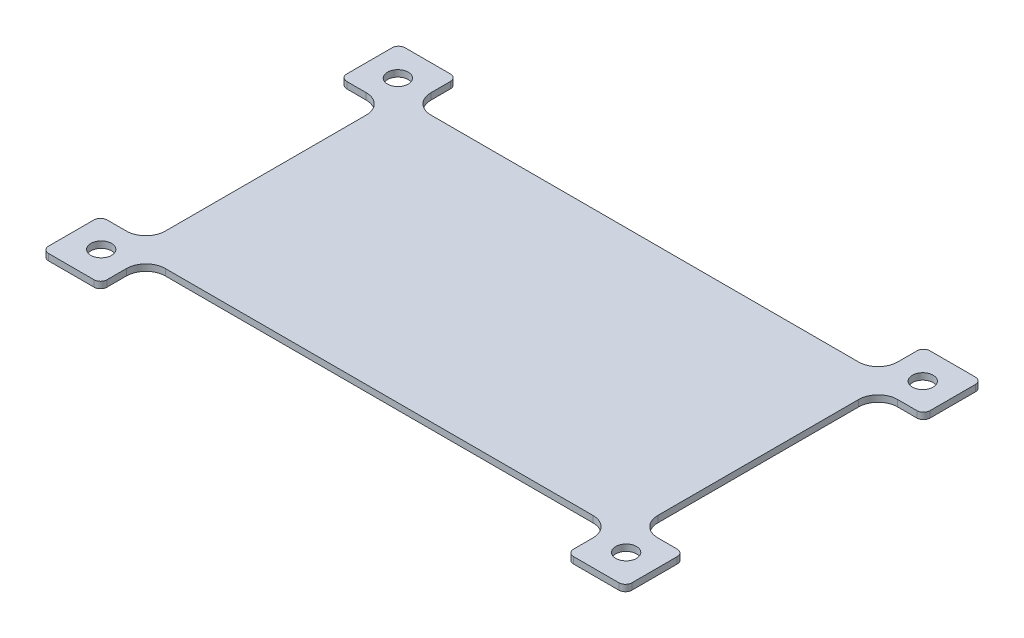
from build123d import *

# Parameters (mm, degrees)
SKETCH1_W            = 76
SKETCH1_H            = 41
BOSS_EXTRUDE1_DEPTH  = 1
SKETCH2_W            = 9
SKETCH2_H            = 9
BOSS_EXTRUDE2_DEPTH  = 1
SKETCH3_R            = 1.6
CUT_EXTRUDE1_DEPTH   = 1
FILLET1_R            = 1
FILLET3_R            = 3
FILLET1_OF_MIRROR2_R = 1
MIRROR3_OUTLINE_R    = 1.6
MIRROR3_DEPTH        = 1
FILLET4_R            = 3


# Read off the part's stored shape, not the designer's step: Mirror3
with BuildPart() as part:
    # Sketch1 → Boss-Extrude1 (new body)
    with BuildSketch(Plane(origin=(0, 0, 0), x_dir=(1, 0, 0), z_dir=(0, 1, 0))):
        Rectangle(SKETCH1_W, SKETCH1_H)
    boss_extrude1 = extrude(amount=BOSS_EXTRUDE1_DEPTH)

    # Sketch2 → Boss-Extrude2 (add)
    with BuildSketch(Plane(origin=(0, 1, 0), x_dir=(1, 0, 0), z_dir=(0, 1, 0))):
        with Locations((40.5, 23)):
            Rectangle(SKETCH2_W, SKETCH2_H)
    boss_extrude2 = extrude(amount=-BOSS_EXTRUDE2_DEPTH)

    # Sketch3 → Cut-Extrude1 (cut)
    with BuildSketch(Plane(origin=(0, 1, 0), x_dir=(1, 0, 0), z_dir=(0, 1, 0))):
        with Locations(Location((40.5, 22.887482194, 0), (0, 0, 270))):
            Circle(SKETCH3_R)
    cut_extrude1 = extrude(amount=-CUT_EXTRUDE1_DEPTH, mode=Mode.SUBTRACT)

    # Fillet1
    fillet1_edges = [part.edges().sort_by_distance(p)[0] for p in [
        (45, 0.5, -18.5),
        (36, 0.5, -27.5),
        (45, 0.5, -27.5),
    ]]
    fillet(fillet1_edges, radius=FILLET1_R)

    # Fillet3
    fillet3_edges = [part.edges().sort_by_distance(p)[0] for p in [
        (36, 0.5, -20.5),
        (38, 0.5, -18.5),
    ]]
    fillet(fillet3_edges, radius=FILLET3_R)

    # Mirror2: Boss-Extrude1, Boss-Extrude2, Cut-Extrude1 across plane
    add(boss_extrude1.mirror(Plane.XY))
    add(boss_extrude2.mirror(Plane.XY))
    add(cut_extrude1.mirror(Plane.XY), mode=Mode.SUBTRACT)

    # Fillet1 of Mirror2
    fillet1_of_mirror2_edges = [part.edges().sort_by_distance(p)[0] for p in [
        (45, 0.5, 18.5),
        (36, 0.5, 27.5),
        (45, 0.5, 27.5),
    ]]
    fillet(fillet1_of_mirror2_edges, radius=FILLET1_OF_MIRROR2_R)

    # Mirror3 outline → Mirror3 (add)
    # profile 1 of 2: a face of its own
    with BuildSketch(Plane(origin=(0, 0, 0), x_dir=(1, 0, 0), z_dir=(0, 1, 0))):
        with BuildLine():
            Line((-38, -20.5), (-38, -18.5))
            Line((-38, -18.5), (-44, -18.5))
            ThreePointArc((-44, -18.5), (-44.707106781, -18.792893219), (-45, -19.5))
            Line((-45, -19.5), (-45, -26.5))
            ThreePointArc((-45, -26.5), (-44.707106781, -27.207106781), (-44, -27.5))
            Line((-44, -27.5), (-37, -27.5))
            ThreePointArc((-37, -27.5), (-36.292893219, -27.207106781), (-36, -26.5))
            Line((-36, -26.5), (-36, -20.5))
            Line((-36, -20.5), (-38, -20.5))
        make_face()
        with Locations((-40.5, -22.887482194)):
            Circle(MIRROR3_OUTLINE_R, mode=Mode.SUBTRACT)
    # profile 2 of 2: a face of its own
    with BuildSketch(Plane(origin=(0, 0, 0), x_dir=(1, 0, 0), z_dir=(0, 1, 0))):
        with BuildLine():
            Line((-44, 18.5), (-38, 18.5))
            Line((-38, 18.5), (-38, 20.5))
            Line((-38, 20.5), (-36, 20.5))
            Line((-36, 20.5), (-36, 26.5))
            ThreePointArc((-36, 26.5), (-36.292893219, 27.207106781), (-37, 27.5))
            Line((-37, 27.5), (-44, 27.5))
            ThreePointArc((-44, 27.5), (-44.707106781, 27.207106781), (-45, 26.5))
            Line((-45, 26.5), (-45, 19.5))
            ThreePointArc((-45, 19.5), (-44.707106781, 18.792893219), (-44, 18.5))
        make_face()
        with Locations((-40.5, 22.887482194)):
            Circle(MIRROR3_OUTLINE_R, mode=Mode.SUBTRACT)
    extrude(amount=MIRROR3_DEPTH)

    # Fillet4
    fillet4_edges = [part.edges().sort_by_distance(p)[0] for p in [
        (-36, 0.5, 20.5),
        (-38, 0.5, 18.5),
        (-36, 0.5, -20.5),
        (-38, 0.5, -18.5),
        (36, 0.5, 20.5),
        (38, 0.5, 18.5),
    ]]
    fillet(fillet4_edges, radius=FILLET4_R)


solid = part.part
